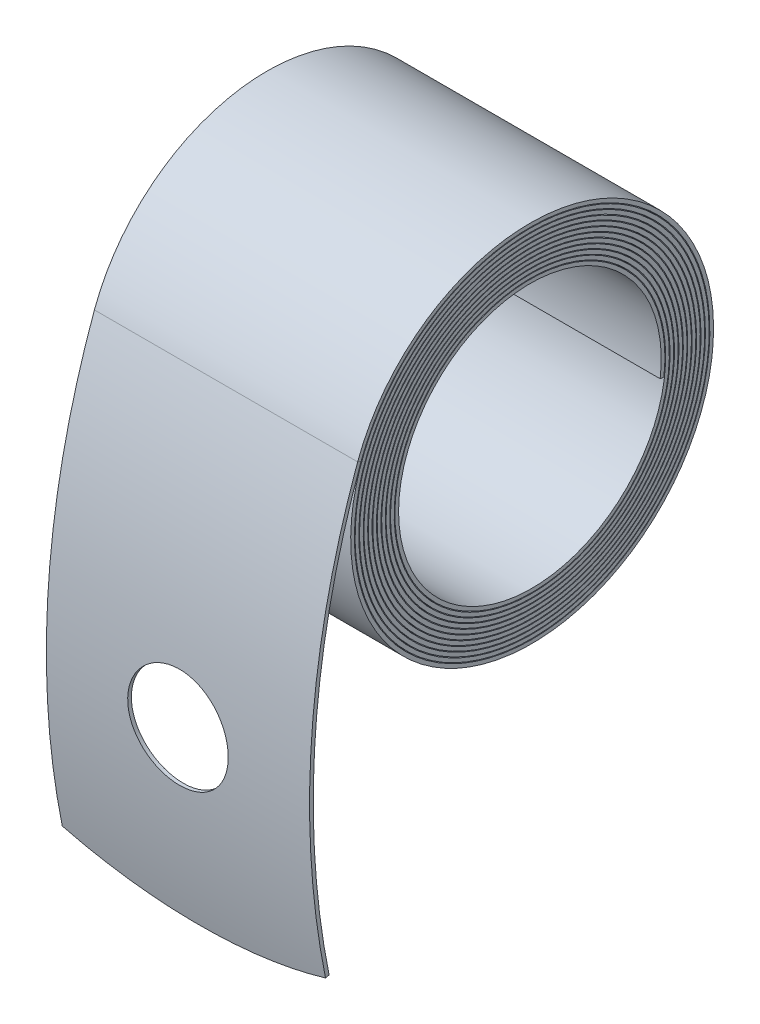
from build123d import *

# Parameters (mm, degrees)
SWEEP1_START            = -6.35
SWEEP1_DEPTH            = 12.7
CUT_EXTRUDE1_START      = -10.68324
SKETCH7_R               = 2.4257
CUT_EXTRUDE1_DEPTH      = 0.254794
CUT_EXTRUDE2_REACH      = 35.88
CUT_EXTRUDE2_END_RADIUS = 38.249313483


# Read off the part's stored shape, not the designer's step: Sweep1
with BuildPart() as part:
    # Sweep1 outline → Sweep1 (new body)
    with BuildSketch(Plane.YZ.offset(SWEEP1_START)):
        with BuildLine():
            add(Edge.make_bspline(
                [(2.983772907, 8.198840116), (3.751462222, 7.916069241), (4.478889027, 7.524636659), (6.207005391, 6.253330708), (7.092079767, 5.218516382), (8.315341468, 2.8654176), (8.652330009, 1.548751345), (8.710240656, -1.097821315), (8.43176041, -2.425713601), (7.318167627, -4.821902603), (6.483316423, -5.888285066), (4.429441538, -7.543618715), (3.211991489, -8.131335921), (0.643170301, -8.708386895), (-0.70628301, -8.69793576), (-3.261746848, -8.083531557), (-4.465674218, -7.479485858), (-6.483347682, -5.802408972), (-7.295823312, -4.730913038), (-8.363972188, -2.340238398), (-8.619067367, -1.022434595), (-8.522504874, 1.589983038), (-8.170609025, 2.882623772), (-6.93230354, 5.179420696), (-6.047386321, 6.182139885), (-3.926785166, 7.694161203), (-2.692255455, 8.201951911), (-0.126263779, 8.621352931), (1.203244635, 8.532671004), (3.685834747, 7.777263136), (4.837379735, 7.11165389), (6.728700353, 5.341568267), (7.466645445, 4.238028268), (8.379909076, 1.818875393), (8.554883909, 0.505198499), (8.307112705, -2.063464249), (7.88453985, -3.3169993), (6.53068817, -5.508941388), (5.600168222, -6.445540237), (3.421433464, -7.811422607), (2.175197479, -8.24019951), (-0.377772517, -8.504237636), (-1.682784305, -8.338766474), (-4.085791412, -7.449770715), (-5.181966539, -6.726947974), (-6.94188239, -4.871813857), (-7.604851223, -3.74120502), (-8.364418004, -1.304274359), (-8.459903942, 0.000352662), (-8.065600774, 2.517593463), (-7.576458317, 3.728378449), (-6.114582337, 5.80884866), (-5.142698222, 6.677382597), (-2.916374502, 7.89695162), (-1.663468012, 8.24680688), (0.867741557, 8.357297738), (2.144101514, 8.118461078), (4.459915086, 7.102852524), (5.497539528, 6.326290873), (7.123954908, 4.395761697), (7.711525243, 3.243284459), (8.31699303, 0.797873666), (8.33505777, -0.493228416), (7.800504077, -2.950456153), (7.247759162, -4.114587846), (5.685634906, -6.079336263), (4.677699791, -6.878698092), (2.413487101, -7.94998916), (1.15848913, -8.221349569), (-1.341836652, -8.183330351), (-2.585274592, -7.873687598), (-4.807319454, -6.737323146), (-5.784517076, -5.911998452), (-7.274342338, -3.915796478), (-7.785507714, -2.745987524), (-8.239834246, -0.301393952), (-8.18267418, 0.971516104), (-7.512105, 3.360580365), (-6.89972892, 4.475249728), (-5.246967067, 6.320000179), (-4.20744479, 7.048311832), (-1.914083626, 7.971524988), (-0.662093949, 8.166051965), (1.798074349, 7.982615989), (3.004889659, 7.604787865), (5.127825702, 6.356471903), (6.04219848, 5.486680716), (7.392700517, 3.433050681), (7.82830077, 2.251094152), (8.133623316, -0.182831746), (8.002614174, -1.43317759), (7.203138939, -3.747575409), (6.535311011, -4.809861759), (4.799547583, -6.529730759), (3.73321656, -7.186545916), (1.421048382, -7.962742777), (0.176812879, -8.081030135), (-2.235828096, -7.756656798), (-3.402465235, -7.314573655), (-5.4198758, -5.961520902), (-6.269555464, -5.051324705), (-7.480490478, -2.950436934), (-7.840588087, -1.761195028), (-7.998634661, 0.653672463), (-7.79704487, 1.877427981), (-6.875342451, 4.109773023), (-6.15539283, 5.116619735), (-4.34591474, 6.709542115), (-3.257794586, 7.294413595), (-0.935753319, 7.923181037), (0.296423808, 7.967200362), (2.653196678, 7.507886446), (3.775888098, 7.004396731), (5.683685961, 5.554067262), (6.467556437, 4.60858216), (7.536984793, 2.469772295), (7.821986949, 1.27763294), (7.83755252, -1.109344382), (7.567831386, -2.302375813), (6.529513502, -4.446353064), (5.76222031, -5.395920747), (3.888383429, -6.858857784), (2.7828249, -7.370817037), (0.459874428, -7.854961308), (-0.75572224, -7.826799442), (-3.048787576, -7.236593809), (-4.124826158, -6.675502248), (-5.918814351, -5.137137697), (-6.635057908, -4.160658465), (-7.563167774, -1.9923132), (-7.774632372, -0.802209229), (-7.650654999, 1.547933095), (-7.315313415, 2.706696562), (-6.168832226, 4.757101654), (-5.358330066, 5.64705738), (-3.428039553, 6.977383234), (-2.310037027, 7.417205944), (0.0043154, 7.758730572), (1.199139566, 7.659705956), (3.42221074, 6.945424367), (4.448748573, 6.330744611), (6.124223668, 4.711668082), (6.772401741, 3.70877877), (7.56014422, 1.520880344), (7.69863547, 0.337381349), (7.439412466, -1.968858133), (7.042209646, -3.08989286), (5.794485173, -5.040519636), (4.944663882, -5.869078182), (2.967717943, -7.066495898), (1.841961247, -7.434222479), (-0.45574988, -7.63478393), (-1.625909236, -7.468017012), (-3.771833262, -6.636055357), (-4.745942629, -5.970980273), (-6.300884929, -4.280118274), (-6.880533078, -3.255659165), (-7.52749972, -1.056781919), (-7.594901566, 0.115980723), (-7.2061591, 2.370235089), (-6.749832184, 3.449912445), (-5.408019504, 5.296848011), (-4.523800374, 6.062892478), (-2.509176204, 7.125502317), (-1.379863602, 7.421528895), (0.892672106, 7.485695133), (2.034172005, 7.25353234), (4.096901433, 6.309271408), (5.016787378, 5.598385446), (6.448223542, 3.844734504), (6.958418726, 2.802874337), (7.467280292, 0.601646693), (7.465577444, -0.556004983), (6.951193865, -2.750749841), (6.439387427, -3.786470484), (5.012367349, -5.525611069), (4.097880939, -6.227390504), (2.053615269, -7.155384257), (0.925510659, -7.381173315), (-1.313235833, -7.311743024), (-2.422692065, -7.016593551), (-4.397170992, -5.968143562), (-5.26057156, -5.215424348), (-6.565996441, -3.406558827), (-7.007458886, -2.352101992), (-7.380101198, -0.157687055), (-7.310563344, 0.980842071), (-6.677073698, 3.110016708), (-6.113640972, 4.099011283), (-4.608435338, 5.72584472), (-3.668074047, 6.362936554), (-1.603790195, 7.157171019), (-0.481287951, 7.313265141), (1.716907731, 7.114368927), (2.790959994, 6.759826942), (4.671202428, 5.613825986), (5.476421983, 4.822997354), (6.655501582, 2.968346064), (7.028257189, 1.905811469), (7.26628116, -0.274093914), (7.131888226, -1.389746445), (6.385418921, -3.446439901), (5.773422761, -4.385914052), (4.198604265, -5.898480797), (3.237030781, -6.470410938), (1.160948163, -7.130497805), (0.048005165, -7.218701805), (-2.101823617, -6.895809482), (-3.136985178, -6.484508286), (-4.919263788, -5.247817749), (-5.665192557, -4.423608684), (-6.716081704, -2.531796758), (-7.020523989, -1.465194713), (-7.128285942, 0.691970165), (-6.93128876, 1.780892999), (-6.07700411, 3.759332292), (-5.420839606, 4.647543032), (-3.785052933, 6.042949297), (-2.806258131, 6.548847658), (-0.72666826, 7.07733821), (0.372490567, 7.099542138), (2.466746616, 6.656377293), (3.460531533, 6.191807896), (5.140849413, 4.872956419), (5.825809476, 4.019338307), (6.748718904, 2.098056855), (6.98622309, 1.031980608), (6.966398237, -1.094162629), (6.709112509, -2.15313388), (5.754791462, -4.048423902), (5.058284415, -4.883185938), (3.368782334, -6.159060359), (2.377380685, -6.599600378), (0.303102104, -6.998278745), (-0.778441456, -6.955712053), (-2.811299076, -6.398542244), (-3.761022137, -5.884402887), (-5.335069165, -4.490123037), (-5.958662074, -3.61129961), (-6.754370415, -1.669813869), (-6.925465381, -0.608483904), (-6.782033087, 1.480186068), (-6.467894189, 2.505951393), (-5.419905953, 4.312335531), (-4.686620037, 5.092049139), (-2.952465215, 6.24803664), (-1.952806401, 6.623237179), (0.108808848, 6.893664631), (1.169125545, 6.789174304), (3.133924008, 6.123870199), (4.036928418, 5.563101127), (5.502819611, 4.101618843), (6.064569144, 3.202077177), (6.73272349, 1.248256796), (6.839143452, 0.195454114), (6.57733164, -1.848199866), (6.208876582, -2.83741715), (5.0738005, -4.551364451), (4.30827515, -5.27493483), (2.537747508, -6.30925922), (1.533655874, -6.619519562), (-0.507373248, -6.765856272), (-1.542753715, -6.601604887), (-3.434000904, -5.833128965), (-4.288603006, -5.229940451), (-5.643538001, -3.709556523), (-6.142634307, -2.793114021), (-6.685682469, -0.834912688), (-6.729230338, 0.20528943), (-6.352623652, 2.197043124), (-5.933196633, 3.147345212), (-4.719218254, 4.764978972), (-3.925270925, 5.430807298), (-2.125720793, 6.343713377), (-1.121617499, 6.590329662), (0.890878119, 6.615143276), (1.898265161, 6.393361308), (3.711238699, 5.529172289), (4.515335359, 4.887243633), (5.757089321, 3.314898852), (6.194167686, 2.385980412), (6.613808075, 0.43187224), (6.59568156, -0.592078452), (6.110293558, -2.526349819), (5.643443415, -3.435141031), (4.357018346, -4.952363518), (3.538667345, -5.560083461), (1.71900325, -6.352287755), (0.718936482, -6.535783005), (-1.25888717, -6.44291719), (-2.235137663, -6.16688764), (-3.964319058, -5.213099165), (-4.716412582, -4.53583992), (-5.844625159, -2.920234574), (-6.219704801, -1.983022601), (-6.517474851, -0.040016951), (-6.440395688, 0.964217095), (-5.851855268, 2.834603352), (-5.340407161, 3.699368391), (-3.989422098, 5.114383308), (-3.150981116, 5.66352395), (-1.318728598, 6.334723994), (-0.32630238, 6.456770381), (1.60958661, 6.251225823), (2.551505517, 5.923397026), (4.193570592, 4.886318364), (4.89258887, 4.178081425), (6.022449077, 2.336666318), (6.35081251, 1.143537349), (6.321293738, -1.233016529), (5.963527991, -2.413769287), (4.67450197, -4.402051065), (3.744759446, -5.207392061), (1.600227109, -6.198305371), (0.388749628, -6.382955738), (-0.779811681, -6.230269621)],
                knots=[5.4e-07, 5.4e-07, 5.4e-07, 5.4e-07, 0.00390625, 0.00390625, 0.010253906, 0.010253906, 0.016601563, 0.016601563, 0.022949219, 0.022949219, 0.029296875, 0.029296875, 0.035644531, 0.035644531, 0.041992188, 0.041992188, 0.048339844, 0.048339844, 0.0546875, 0.0546875, 0.061035156, 0.061035156, 0.067382813, 0.067382813, 0.073730469, 0.073730469, 0.080078125, 0.080078125, 0.086425781, 0.086425781, 0.092773438, 0.092773438, 0.099121094, 0.099121094, 0.10546875, 0.10546875, 0.111816406, 0.111816406, 0.118164063, 0.118164063, 0.124511719, 0.124511719, 0.130859375, 0.130859375, 0.137207031, 0.137207031, 0.143554688, 0.143554688, 0.149902344, 0.149902344, 0.15625, 0.15625, 0.162597656, 0.162597656, 0.168945313, 0.168945313, 0.175292969, 0.175292969, 0.181640625, 0.181640625, 0.187988281, 0.187988281, 0.194335938, 0.194335938, 0.200683594, 0.200683594, 0.20703125, 0.20703125, 0.213378906, 0.213378906, 0.219726563, 0.219726563, 0.226074219, 0.226074219, 0.232421875, 0.232421875, 0.238769531, 0.238769531, 0.245117188, 0.245117188, 0.251464844, 0.251464844, 0.2578125, 0.2578125, 0.264160156, 0.264160156, 0.270507813, 0.270507813, 0.276855469, 0.276855469, 0.283203125, 0.283203125, 0.289550781, 0.289550781, 0.295898438, 0.295898438, 0.302246094, 0.302246094, 0.30859375, 0.30859375, 0.314941406, 0.314941406, 0.321289063, 0.321289063, 0.327636719, 0.327636719, 0.333984375, 0.333984375, 0.340332031, 0.340332031, 0.346679688, 0.346679688, 0.353027344, 0.353027344, 0.359375, 0.359375, 0.365722656, 0.365722656, 0.372070313, 0.372070313, 0.378417969, 0.378417969, 0.384765625, 0.384765625, 0.391113281, 0.391113281, 0.397460938, 0.397460938, 0.403808594, 0.403808594, 0.41015625, 0.41015625, 0.416503906, 0.416503906, 0.422851563, 0.422851563, 0.429199219, 0.429199219, 0.435546875, 0.435546875, 0.441894531, 0.441894531, 0.448242188, 0.448242188, 0.454589844, 0.454589844, 0.4609375, 0.4609375, 0.467285156, 0.467285156, 0.473632813, 0.473632813, 0.479980469, 0.479980469, 0.486328125, 0.486328125, 0.492675781, 0.492675781, 0.499023438, 0.499023438, 0.505371094, 0.505371094, 0.51171875, 0.51171875, 0.518066406, 0.518066406, 0.524414063, 0.524414063, 0.530761719, 0.530761719, 0.537109375, 0.537109375, 0.543457031, 0.543457031, 0.549804688, 0.549804688, 0.556152344, 0.556152344, 0.5625, 0.5625, 0.568847656, 0.568847656, 0.575195313, 0.575195313, 0.581542969, 0.581542969, 0.587890625, 0.587890625, 0.594238281, 0.594238281, 0.600585938, 0.600585938, 0.606933594, 0.606933594, 0.61328125, 0.61328125, 0.619628906, 0.619628906, 0.625976563, 0.625976563, 0.632324219, 0.632324219, 0.638671875, 0.638671875, 0.645019531, 0.645019531, 0.651367188, 0.651367188, 0.657714844, 0.657714844, 0.6640625, 0.6640625, 0.670410156, 0.670410156, 0.676757813, 0.676757813, 0.683105469, 0.683105469, 0.689453125, 0.689453125, 0.695800781, 0.695800781, 0.702148438, 0.702148438, 0.708496094, 0.708496094, 0.71484375, 0.71484375, 0.721191406, 0.721191406, 0.727539063, 0.727539063, 0.733886719, 0.733886719, 0.740234375, 0.740234375, 0.746582031, 0.746582031, 0.752929688, 0.752929688, 0.759277344, 0.759277344, 0.765625, 0.765625, 0.771972656, 0.771972656, 0.778320313, 0.778320313, 0.784667969, 0.784667969, 0.791015625, 0.791015625, 0.797363281, 0.797363281, 0.803710938, 0.803710938, 0.810058594, 0.810058594, 0.81640625, 0.81640625, 0.822753906, 0.822753906, 0.829101563, 0.829101563, 0.835449219, 0.835449219, 0.841796875, 0.841796875, 0.848144531, 0.848144531, 0.854492188, 0.854492188, 0.860839844, 0.860839844, 0.8671875, 0.8671875, 0.873535156, 0.873535156, 0.879882813, 0.879882813, 0.886230469, 0.886230469, 0.892578125, 0.892578125, 0.898925781, 0.898925781, 0.905273438, 0.905273438, 0.911621094, 0.911621094, 0.91796875, 0.91796875, 0.924316406, 0.924316406, 0.930664063, 0.930664063, 0.937011719, 0.937011719, 0.943359375, 0.943359375, 0.949707031, 0.949707031, 0.956054688, 0.956054688, 0.962402344, 0.962402344, 0.96875, 0.96875, 0.9765625, 0.9765625, 0.984375, 0.984375, 0.9921875, 0.9921875, 1, 1, 1, 1], degree=3))
            Line((-0.779811681, -6.230269621), (-0.802847511, -6.40657104))
            add(Edge.make_bspline(
                [(3.04490273, 8.365801495), (3.828458385, 8.077221236), (4.570638223, 7.677870053), (6.334337848, 6.380386948), (7.237370436, 5.324506516), (8.485564283, 2.923447594), (8.829495115, 1.579711672), (8.888590451, -1.121002488), (8.6044457, -2.476016021), (7.467959371, -4.921466532), (6.615919308, -6.0097711), (4.519984339, -7.699003343), (3.277460943, -8.298859916), (0.655639335, -8.887816719), (-0.721519741, -8.877139141), (-3.329637342, -8.250075517), (-4.558541733, -7.633495332), (-6.617784196, -5.921866569), (-7.447029961, -4.82834708), (-8.537432696, -2.387865024), (-8.797744338, -1.042875424), (-8.699185232, 1.623558899), (-8.339962079, 2.943167642), (-7.075956727, 5.287632427), (-6.17272351, 6.311140398), (-4.007892664, 7.854698168), (-2.74759191, 8.373066664), (-0.128287586, 8.801181422), (1.229018622, 8.710677297), (3.763577383, 7.939456297), (4.939104279, 7.259971548), (6.869963997, 5.45288131), (7.623441408, 4.326109594), (8.555796012, 1.856386458), (8.734481385, 0.515277699), (8.481472366, -2.107685879), (8.050014006, -3.387437866), (6.667757467, -5.625368599), (5.717551131, -6.581802008), (3.492932984, -7.976449382), (2.220505283, -8.414261989), (-0.386497912, -8.68388844), (-1.719143258, -8.514892591), (-4.17281455, -7.607153547), (-5.292263754, -6.869022123), (-7.089565842, -4.974479029), (-7.766539512, -3.819963565), (-8.542220996, -1.331331833), (-8.639744516, 0.001166582), (-8.2370763, 2.571810056), (-7.737617224, 3.80828246), (-6.244377401, 5.933388154), (-5.251822627, 6.820334171), (-2.978092192, 8.065872357), (-1.698273356, 8.423256891), (0.887039228, 8.536109422), (2.190637222, 8.292199308), (4.556198511, 7.25477371), (5.616113647, 6.461503896), (7.277334162, 4.489661579), (7.877586172, 3.312380826), (8.496109341, 0.814240936), (8.514550071, -0.50456533), (7.968484716, -3.014709686), (7.403751296, -4.20408505), (5.807987035, -6.211143895), (4.778398128, -7.027750733), (2.464873552, -8.122373259), (1.182809566, -8.399539932), (-1.371563613, -8.360698885), (-2.642122519, -8.044316823), (-4.912382743, -6.883294802), (-5.910762431, -6.04011034), (-7.433078229, -4.000374621), (-7.955379126, -2.805030619), (-8.419576258, -0.307326342), (-8.36119868, 0.993414591), (-7.675949742, 3.434779026), (-7.050222709, 4.573726282), (-5.361324385, 6.4588109), (-4.298913462, 7.2031562), (-1.955408869, 8.146555044), (-0.676074412, 8.34538794), (1.838495793, 8.157895629), (3.071715023, 7.771753911), (5.241246281, 6.496039314), (6.175876835, 5.606997454), (7.556134359, 3.508119977), (8.001337439, 2.300174265), (8.313421325, -0.187650699), (8.179488885, -1.465700218), (7.362375837, -3.831157672), (6.67974862, -4.917045333), (4.905397949, -6.675148232), (3.815470252, -7.346484477), (1.451963339, -8.139915796), (0.179907258, -8.260845936), (-2.286305641, -7.929269991), (-3.478848364, -7.477430842), (-5.541565461, -6.093991549), (-6.410102064, -5.163529624), (-7.648030263, -3.01581056), (-8.016240162, -1.799826224), (-8.177823444, 0.669080281), (-7.971753228, 1.92017768), (-7.0293198, 4.202732815), (-6.293150259, 5.232228023), (-4.443124941, 6.860844998), (-3.330482621, 7.458934086), (-0.956008276, 8.101899472), (0.303858377, 8.146896609), (2.713785552, 7.677223395), (3.861975185, 7.162296419), (5.812804397, 5.679254033), (6.614386267, 4.712494852), (7.708211879, 2.524891544), (7.999606929, 1.305818643), (8.015524979, -1.135211254), (7.739655277, -2.355503697), (6.677732989, -4.548220651), (5.893044349, -5.519353395), (3.976389695, -7.015719013), (2.845543987, -7.53936585), (0.469709661, -8.034532059), (-0.773737811, -8.005757488), (-3.119409919, -7.402011546), (-4.220010702, -6.828099487), (-6.055108497, -5.254483), (-6.787879085, -4.255468731), (-7.737259, -2.037430202), (-7.953622411, -0.820081366), (-7.826771192, 1.584538199), (-7.483691408, 2.769879973), (-6.310829958, 4.867464403), (-5.481521583, 5.778091241), (-3.506640426, 7.139148265), (-2.362863349, 7.589135954), (0.005228694, 7.938590836), (1.227813532, 7.837245221), (3.502315403, 7.106438745), (4.552770395, 6.477475673), (6.267308355, 4.820651184), (6.930516509, 3.794486036), (7.736604188, 1.55563513), (7.878341692, 0.34437945), (7.613080995, -2.015575815), (7.206686934, -3.162721903), (5.929566766, -5.159304362), (5.059893906, -6.007155459), (3.03671371, -7.232576833), (1.884396971, -7.608994425), (-0.467263745, -7.814264999), (-1.664855855, -7.643612316), (-3.861428309, -6.792014574), (-4.858533006, -6.111215059), (-6.450041808, -4.380590228), (-7.043436827, -3.331901628), (-7.705736344, -1.08091179), (-7.774716865, 0.119512682), (-7.37677139, 2.427133793), (-6.90956339, 3.532551677), (-5.535979522, 5.423218634), (-4.630875733, 6.207432148), (-2.56799912, 7.29549265), (-1.411898019, 7.598495248), (0.91466997, 7.664187115), (2.083557964, 7.426468893), (4.195528033, 6.459666947), (5.137351549, 5.731857657), (6.603137791, 3.936124473), (7.125566644, 2.869236694), (7.646595305, 0.615376765), (7.644884328, -0.570132507), (7.118105283, -2.817765694), (6.594014378, -3.878321032), (5.132642736, -5.659326619), (4.195985201, -6.378118257), (2.102499439, -7.328455456), (0.947262621, -7.559733393), (-1.346010726, -7.488612059), (-2.482206985, -7.186302917), (-4.504426641, -6.11250256), (-5.388901559, -5.34143005), (-6.726017956, -3.488651093), (-7.178202246, -2.408646283), (-7.559938947, -0.160676335), (-7.488682945, 1.005657342), (-6.839788114, 3.186609192), (-6.262594301, 4.199825232), (-4.720496998, 5.866531361), (-3.757191371, 6.519154736), (-1.642364926, 7.332835495), (-0.492182894, 7.492777266), (1.759847019, 7.289010046), (2.860203946, 6.925845391), (4.787028986, 5.751452505), (5.611967224, 4.941195421), (6.82004684, 3.040928111), (7.20206755, 1.952028186), (7.445969753, -0.281712064), (7.308286983, -1.424875229), (6.543284724, -3.532631206), (5.916066552, -4.495436378), (4.302287583, -6.045423508), (3.316788403, -6.631622816), (1.188937888, -7.308169196), (0.048373739, -7.398551418), (-2.155008925, -7.067615599), (-3.216140991, -6.645994079), (-5.042829795, -5.37848812), (-5.807376279, -4.533793258), (-6.884756505, -2.594292058), (-7.19675409, -1.501059014), (-7.307212963, 0.710092462), (-7.105255524, 1.826517475), (-6.229502806, 3.854674704), (-5.556894587, 4.765184845), (-3.879780259, 6.195845627), (-2.876228922, 6.714517452), (-0.744282825, 7.256313402), (0.382727289, 7.279113178), (2.530128083, 6.824702391), (3.549008244, 6.348389797), (5.271926091, 4.996102367), (5.974375045, 4.120687095), (6.92068973, 2.150681375), (7.164269686, 1.057598212), (7.143936184, -1.123095819), (6.880072091, -2.208956089), (5.901441426, -4.152525226), (5.18704216, -5.008754532), (3.454323784, -6.31726494), (2.437612502, -6.769078056), (0.309988483, -7.178009469), (-0.7993904, -7.13432766), (-2.884347068, -6.562878436), (-3.858584204, -6.035506139), (-5.473294174, -4.60520734), (-6.112912262, -3.703781503), (-6.929157695, -1.712186357), (-7.10469926, -0.62326642), (-6.957563695, 1.519330827), (-6.635374139, 2.571581562), (-5.560009997, 4.425152683), (-4.807727413, 5.225001394), (-3.02859556, 6.410970582), (-2.002778296, 6.796005348), (0.11253195, 7.073476113), (1.200424163, 6.966292776), (3.216674822, 6.283566346), (4.143334626, 5.708084275), (5.647481586, 4.208461284), (6.224015308, 3.285308611), (6.909746838, 1.280088941), (7.018942883, 0.199718702), (6.750249575, -1.897650956), (6.372039169, -2.913056279), (5.20711682, -4.672070983), (4.4215137, -5.414698505), (2.603881693, -6.476540789), (1.573328873, -6.794931514), (-0.521615891, -6.945133842), (-1.584599589, -6.776519022), (-3.526018144, -5.987656823), (-4.403270604, -5.36851137), (-5.794346984, -3.807572892), (-6.306749934, -2.866656229), (-6.864234242, -0.856398964), (-6.908980957, 0.211635081), (-6.52228179, 2.256764716), (-6.091657718, 3.232410528), (-4.845173602, 4.893358385), (-4.029812859, 5.577143531), (-2.18205654, 6.514504456), (-1.151084131, 6.767779859), (0.915960617, 6.793266052), (1.950372891, 6.565489416), (3.812140656, 5.678041681), (4.638086978, 5.018689717), (5.913404967, 3.403845194), (6.362301733, 2.449867039), (6.793347619, 0.442647743), (6.774708808, -0.609155962), (6.276172481, -2.595823409), (5.796623101, -3.529409465), (4.475067606, -5.088065123), (3.634466288, -5.712295771), (1.765148917, -6.526116988), (0.737594803, -6.714654963), (-1.294223794, -6.619253894), (-2.297127814, -6.335748758), (-4.074077713, -5.35561195), (-4.846712811, -4.659796174), (-6.005873466, -2.999873043), (-6.391351136, -2.036721487), (-6.697324805, -0.040185673), (-6.61814996, 0.991675777), (-6.013304584, 2.91387932), (-5.487658728, 3.802612637), (-4.099369524, 5.256699722), (-3.237642869, 5.821131994), (-1.354383253, 6.511017218), (-0.334455904, 6.636435476), (1.655285212, 6.425173125), (2.623597155, 6.088157785), (4.311364889, 5.022214705), (5.029870247, 4.294316879), (6.191552908, 2.40103841), (6.529015747, 1.174897811), (6.498663073, -1.268793498), (6.130980789, -2.4823217), (4.805429721, -4.526942205), (3.849813323, -5.354713329), (1.644330424, -6.373789759), (0.398951347, -6.56360003), (-0.802847511, -6.40657104)],
                knots=[0, 0, 0, 0, 0.00390625, 0.00390625, 0.010253906, 0.010253906, 0.016601562, 0.016601562, 0.022949219, 0.022949219, 0.029296875, 0.029296875, 0.035644531, 0.035644531, 0.041992188, 0.041992188, 0.048339844, 0.048339844, 0.0546875, 0.0546875, 0.061035156, 0.061035156, 0.067382812, 0.067382812, 0.073730469, 0.073730469, 0.080078125, 0.080078125, 0.086425781, 0.086425781, 0.092773438, 0.092773438, 0.099121094, 0.099121094, 0.10546875, 0.10546875, 0.111816406, 0.111816406, 0.118164062, 0.118164062, 0.124511719, 0.124511719, 0.130859375, 0.130859375, 0.137207031, 0.137207031, 0.143554688, 0.143554688, 0.149902344, 0.149902344, 0.15625, 0.15625, 0.162597656, 0.162597656, 0.168945312, 0.168945312, 0.175292969, 0.175292969, 0.181640625, 0.181640625, 0.187988281, 0.187988281, 0.194335938, 0.194335938, 0.200683594, 0.200683594, 0.20703125, 0.20703125, 0.213378906, 0.213378906, 0.219726562, 0.219726562, 0.226074219, 0.226074219, 0.232421875, 0.232421875, 0.238769531, 0.238769531, 0.245117188, 0.245117188, 0.251464844, 0.251464844, 0.2578125, 0.2578125, 0.264160156, 0.264160156, 0.270507812, 0.270507812, 0.276855469, 0.276855469, 0.283203125, 0.283203125, 0.289550781, 0.289550781, 0.295898438, 0.295898438, 0.302246094, 0.302246094, 0.30859375, 0.30859375, 0.314941406, 0.314941406, 0.321289062, 0.321289062, 0.327636719, 0.327636719, 0.333984375, 0.333984375, 0.340332031, 0.340332031, 0.346679688, 0.346679688, 0.353027344, 0.353027344, 0.359375, 0.359375, 0.365722656, 0.365722656, 0.372070312, 0.372070312, 0.378417969, 0.378417969, 0.384765625, 0.384765625, 0.391113281, 0.391113281, 0.397460938, 0.397460938, 0.403808594, 0.403808594, 0.41015625, 0.41015625, 0.416503906, 0.416503906, 0.422851562, 0.422851562, 0.429199219, 0.429199219, 0.435546875, 0.435546875, 0.441894531, 0.441894531, 0.448242188, 0.448242188, 0.454589844, 0.454589844, 0.4609375, 0.4609375, 0.467285156, 0.467285156, 0.473632812, 0.473632812, 0.479980469, 0.479980469, 0.486328125, 0.486328125, 0.492675781, 0.492675781, 0.499023438, 0.499023438, 0.505371094, 0.505371094, 0.51171875, 0.51171875, 0.518066406, 0.518066406, 0.524414062, 0.524414062, 0.530761719, 0.530761719, 0.537109375, 0.537109375, 0.543457031, 0.543457031, 0.549804688, 0.549804688, 0.556152344, 0.556152344, 0.5625, 0.5625, 0.568847656, 0.568847656, 0.575195312, 0.575195312, 0.581542969, 0.581542969, 0.587890625, 0.587890625, 0.594238281, 0.594238281, 0.600585938, 0.600585938, 0.606933594, 0.606933594, 0.61328125, 0.61328125, 0.619628906, 0.619628906, 0.625976562, 0.625976562, 0.632324219, 0.632324219, 0.638671875, 0.638671875, 0.645019531, 0.645019531, 0.651367188, 0.651367188, 0.657714844, 0.657714844, 0.6640625, 0.6640625, 0.670410156, 0.670410156, 0.676757812, 0.676757812, 0.683105469, 0.683105469, 0.689453125, 0.689453125, 0.695800781, 0.695800781, 0.702148438, 0.702148438, 0.708496094, 0.708496094, 0.71484375, 0.71484375, 0.721191406, 0.721191406, 0.727539062, 0.727539062, 0.733886719, 0.733886719, 0.740234375, 0.740234375, 0.746582031, 0.746582031, 0.752929688, 0.752929688, 0.759277344, 0.759277344, 0.765625, 0.765625, 0.771972656, 0.771972656, 0.778320312, 0.778320312, 0.784667969, 0.784667969, 0.791015625, 0.791015625, 0.797363281, 0.797363281, 0.803710938, 0.803710938, 0.810058594, 0.810058594, 0.81640625, 0.81640625, 0.822753906, 0.822753906, 0.829101562, 0.829101562, 0.835449219, 0.835449219, 0.841796875, 0.841796875, 0.848144531, 0.848144531, 0.854492188, 0.854492188, 0.860839844, 0.860839844, 0.8671875, 0.8671875, 0.873535156, 0.873535156, 0.879882812, 0.879882812, 0.886230469, 0.886230469, 0.892578125, 0.892578125, 0.898925781, 0.898925781, 0.905273438, 0.905273438, 0.911621094, 0.911621094, 0.91796875, 0.91796875, 0.924316406, 0.924316406, 0.930664062, 0.930664062, 0.937011719, 0.937011719, 0.943359375, 0.943359375, 0.949707031, 0.949707031, 0.956054688, 0.956054688, 0.962402344, 0.962402344, 0.96875, 0.96875, 0.9765625, 0.9765625, 0.984375, 0.984375, 0.9921875, 0.9921875, 1, 1, 1, 1], degree=3))
            ThreePointArc((3.04490273, 8.365801495), (-7.786852424, 10.613679955), (-18.810144131, 9.682596051))
            Line((-18.810144131, 9.682596051), (-18.769833293, 9.509425972))
            ThreePointArc((-18.769833293, 9.509425972), (-7.797714948, 10.436212001), (2.983772907, 8.198840116))
        make_face()
    extrude(amount=SWEEP1_DEPTH)

    # Sketch7 → Cut-Extrude1 (cut)
    with BuildSketch(Plane(origin=(0, -4.268002453, 0), x_dir=(1, 0, 0), z_dir=(0, 0, -1)).offset(CUT_EXTRUDE1_START)):
        with Locations((0, 5.829941678)):
            Circle(SKETCH7_R)
    extrude(amount=CUT_EXTRUDE1_DEPTH, mode=Mode.SUBTRACT)

    # Cut-Extrude2: up to this cylinder (the profile starts outside it)
    cut_extrude2_end = Plane(origin=(6.222291, -10.097944131, -27.743873483), z_dir=(-1, 0, 0)) * Cylinder(CUT_EXTRUDE2_END_RADIUS, 149.258626966, mode=Mode.PRIVATE)
    # Sketch8 → Cut-Extrude2 (cut, up to the surface)
    with BuildSketch(Plane(origin=(0, -18.810144131, 9.682596051), x_dir=(-1, 0, 0), z_dir=(0, 0.22672012572132785, -0.9739599501996503)), mode=Mode.PRIVATE) as cut_extrude2_sk1:
        with BuildLine():
            Line((-6.35, 1.089487758), (-6.35, -0.254))
            Line((-6.35, -0.254), (6.35, -0.254))
            Line((6.35, -0.254), (6.35, 1.089487758))
            ThreePointArc((6.35, 1.089487758), (0, 0), (-6.35, 1.089487758))
        make_face()
    cut_extrude2_tool1 = extrude(cut_extrude2_sk1.sketch, amount=CUT_EXTRUDE2_REACH, mode=Mode.PRIVATE) - cut_extrude2_end
    add(cut_extrude2_tool1.solids().sort_by_distance((6.222291, -18.403278, 9.777307))[0], mode=Mode.SUBTRACT)


solid = part.part
